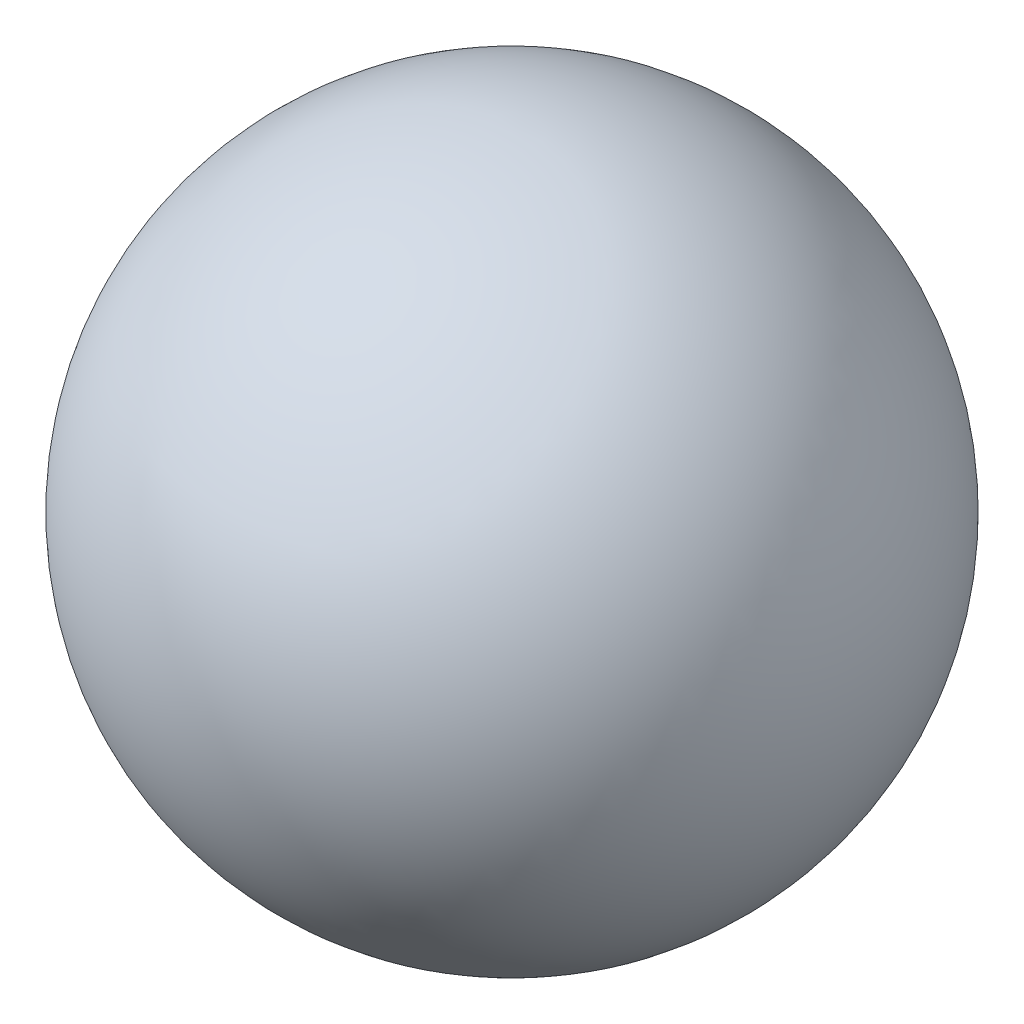
from build123d import *


with BuildPart() as part:
    # Sketch1 → Revolve2 (revolve)
    with BuildSketch(Plane.XY):
        with BuildLine():
            Line((0, -21), (0, 21))
            ThreePointArc((0, 21), (21, 0), (0, -21))
        make_face()
    revolve(axis=Axis((0, -21, 0), (0, 1, 0)))


solid = part.part
